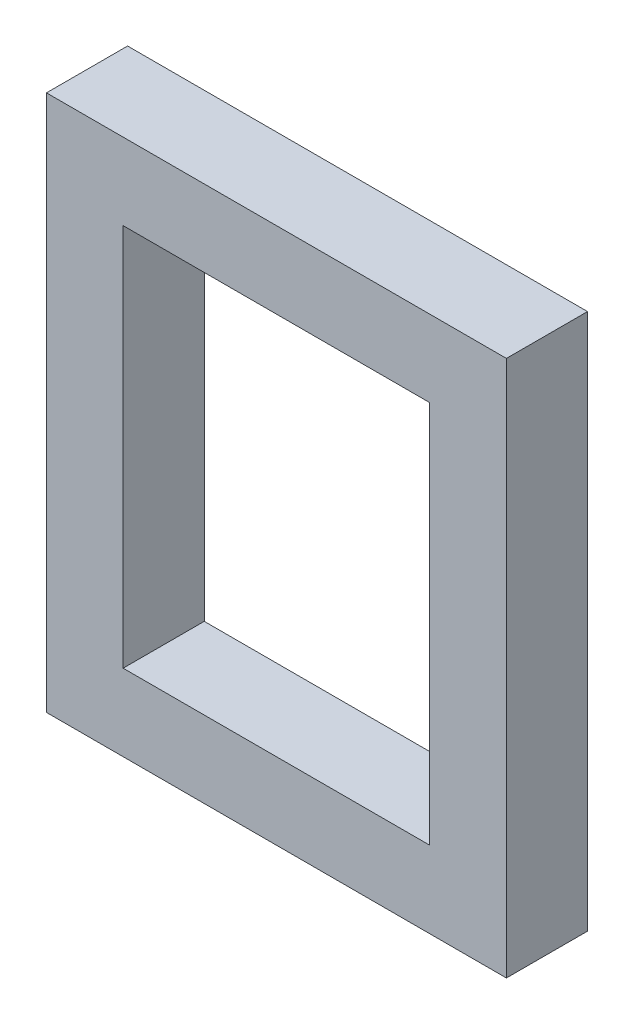
from build123d import *

# Parameters (mm, degrees)
SKETCH1_W           = 18
SKETCH1_H           = 21
SKETCH1_W_2         = 12
SKETCH1_H_2         = 15
BOSS_EXTRUDE1_DEPTH = 3.175


with BuildPart() as part:
    # Sketch1 → Boss-Extrude1 (new body)
    with BuildSketch(Plane.XY):
        Rectangle(SKETCH1_W, SKETCH1_H)
        Rectangle(SKETCH1_W_2, SKETCH1_H_2, mode=Mode.SUBTRACT)
    extrude(amount=BOSS_EXTRUDE1_DEPTH)


solid = part.part
